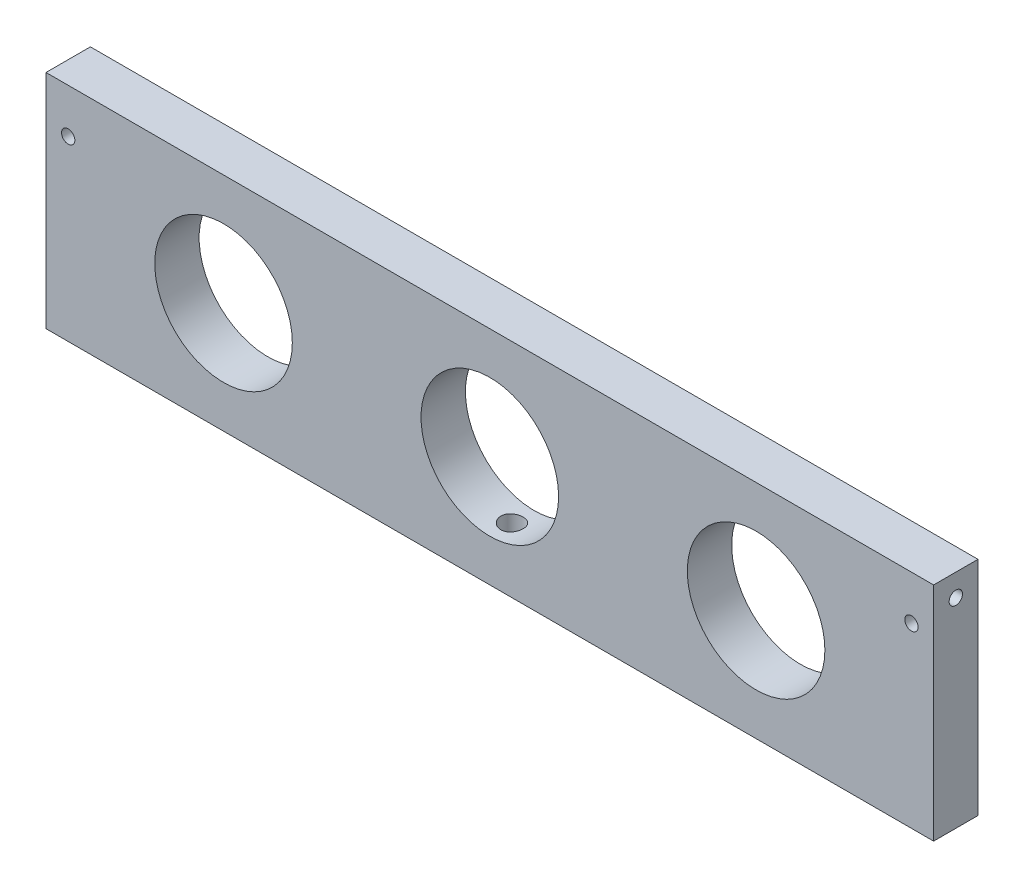
from build123d import *

# Parameters (mm, degrees)
SKETCH1_W           = 200
SKETCH1_H           = 50
SKETCH1_R           = 15.5
SKETCH1_R_2         = 1.5
BOSS_EXTRUDE1_DEPTH = 10
SKETCH2_R           = 2.5
CUT_EXTRUDE1_DEPTH  = 10
SKETCH3_R           = 1.5
CUT_EXTRUDE2_DEPTH  = 200


with BuildPart() as part:
    # Sketch1 → Boss-Extrude1 (new body)
    with BuildSketch(Plane.XY):
        Rectangle(SKETCH1_W, SKETCH1_H)
        Circle(SKETCH1_R, mode=Mode.SUBTRACT)
        with Locations((60, 0)):
            Circle(SKETCH1_R, mode=Mode.SUBTRACT)
        with Locations((-60, 0)):
            Circle(SKETCH1_R, mode=Mode.SUBTRACT)
        with Locations((95, 15)):
            Circle(SKETCH1_R_2, mode=Mode.SUBTRACT)
        with Locations((-95, 15)):
            Circle(SKETCH1_R_2, mode=Mode.SUBTRACT)
    extrude(amount=BOSS_EXTRUDE1_DEPTH)

    # Sketch2 → Cut-Extrude1 (cut)
    with BuildSketch(Plane.XZ.offset(25)):
        with Locations((-95, 5)):
            Circle(SKETCH2_R)
        with Locations((0, 5)):
            Circle(SKETCH2_R)
        with Locations((95, 5)):
            Circle(SKETCH2_R)
    extrude(amount=-CUT_EXTRUDE1_DEPTH, mode=Mode.SUBTRACT)

    # Sketch3 → Cut-Extrude2 (cut)
    with BuildSketch(Plane(origin=(100, 0, 0), x_dir=(0, 0, -1), z_dir=(1, 0, 0))):
        with Locations((-5, 20)):
            Circle(SKETCH3_R)
    extrude(amount=-CUT_EXTRUDE2_DEPTH, mode=Mode.SUBTRACT)


solid = part.part
